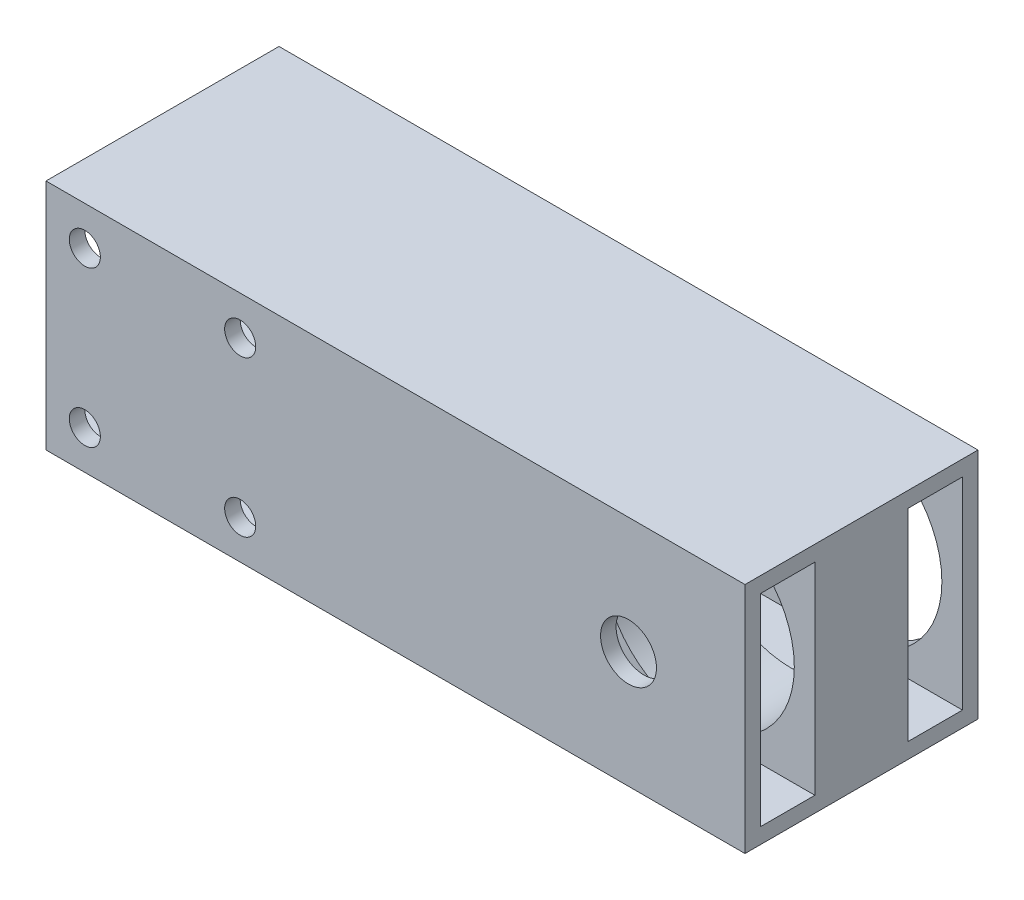
from build123d import *

# Parameters (mm, degrees)
SKETCH1_W           = 30
SKETCH1_H           = 30
SKETCH1_W_2         = 7
SKETCH1_H_2         = 26
BOSS_EXTRUDE3_DEPTH = 90
SKETCH6_R           = 12.35
CUT_EXTRUDE5_DEPTH  = 23
SKETCH8_R           = 3.6
CUT_EXTRUDE6_DEPTH  = 17
SKETCH9_W           = 12
SKETCH9_H           = 26
CUT_EXTRUDE7_DEPTH  = 59
SKETCH10_R          = 2
CUT_EXTRUDE8_DEPTH  = 34


with BuildPart() as part:
    # Sketch1 → Boss-Extrude3 (new body)
    with BuildSketch(Plane(origin=(0, 0, 0), x_dir=(0, 0, -1), z_dir=(1, 0, 0))):
        Rectangle(SKETCH1_W, SKETCH1_H)
        with Locations((-9.5, 0)):
            Rectangle(SKETCH1_W_2, SKETCH1_H_2, mode=Mode.SUBTRACT)
        with Locations((9.5, 0)):
            Rectangle(SKETCH1_W_2, SKETCH1_H_2, mode=Mode.SUBTRACT)
    extrude(amount=BOSS_EXTRUDE3_DEPTH)

    # Sketch6 → Cut-Extrude5 (cut)
    with BuildSketch(Plane(origin=(0, 0, -15), x_dir=(-1, 0, 0), z_dir=(0, 0, -1))):
        with Locations((-75, 0)):
            Circle(SKETCH6_R)
    extrude(amount=-CUT_EXTRUDE5_DEPTH, mode=Mode.SUBTRACT)

    # Sketch8 → Cut-Extrude6 (cut)
    with BuildSketch(Plane.XY.offset(15)):
        with Locations((75, 0)):
            Circle(SKETCH8_R)
    extrude(amount=-CUT_EXTRUDE6_DEPTH, mode=Mode.SUBTRACT)

    # Sketch9 → Cut-Extrude7 (cut)
    with BuildSketch(Plane.ZY):
        Rectangle(SKETCH9_W, SKETCH9_H)
    extrude(amount=-CUT_EXTRUDE7_DEPTH, mode=Mode.SUBTRACT)

    # Sketch10 → Cut-Extrude8 (cut)
    with BuildSketch(Plane(origin=(0, 0, -15), x_dir=(-1, 0, 0), z_dir=(0, 0, -1))):
        with Locations((-25.002859351, 10)):
            Circle(SKETCH10_R)
        with Locations((-5, 10)):
            Circle(SKETCH10_R)
        with Locations((-25.002859351, -10)):
            Circle(SKETCH10_R)
        with Locations((-5, -10)):
            Circle(SKETCH10_R)
    extrude(amount=-CUT_EXTRUDE8_DEPTH, mode=Mode.SUBTRACT)


solid = part.part
